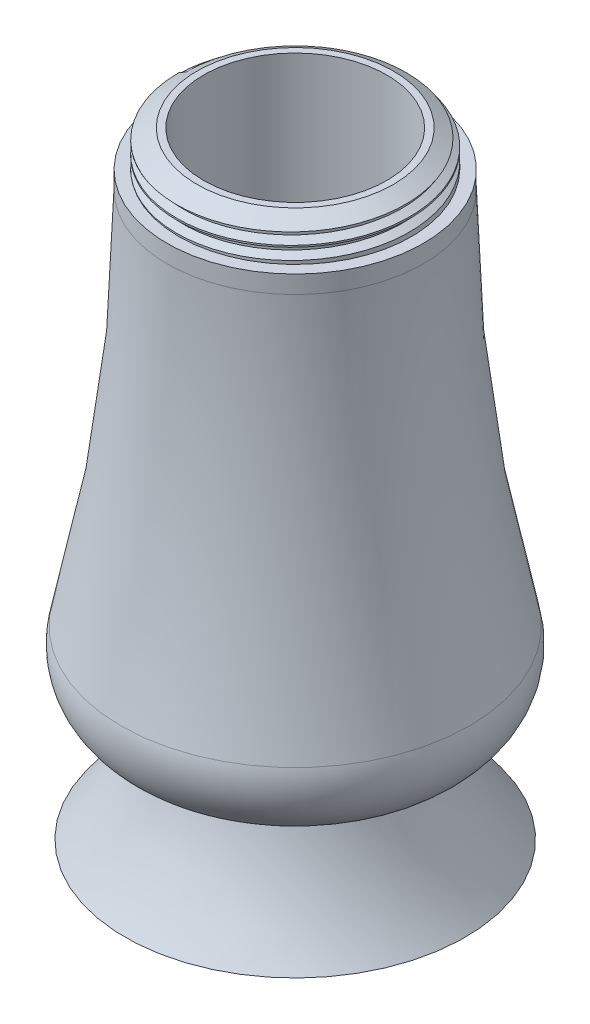
from build123d import *
from build123d.topology import SkipClean

# Parameters (mm, degrees)
GWINT1_PITCH               = 1
SZKIC10_R                  = 7
WYTNIJ_WYCI_GNI_CIE2_DEPTH = 25
ZAOKR_GLENIE1_R            = 5


with BuildPart() as part:
    # Szkic2 → Obrót1 (revolve)
    with BuildSketch(Plane.XY, mode=Mode.PRIVATE) as obr_t1_sk:
        with BuildLine():
            Line((0, 0), (0, 8))
            Line((0, 8), (9.027373354, 8))
            ThreePointArc((9.027373354, 8), (10.570833484, 3.780088701), (13, 0))
            Line((13, 0), (0, 0))
        make_face()
    revolve(obr_t1_sk.sketch.rotate(Axis((0, 0, 0), (0, 1, 0)), 90), axis=Axis((0, 0, 0), (0, 1, 0)))

    # Szkic4 → Obrót2 (revolve)
    with BuildSketch(Plane.XY, mode=Mode.PRIVATE) as obr_t2_sk:
        with BuildLine():
            Line((0, 8), (0, 43))
            Line((0, 43), (0, 47.12232406))
            Line((0, 47.12232406), (8.9, 47.12232406))
            Line((8.9, 47.12232406), (8.9, 45.06116203))
            Line((8.9, 45.06116203), (8.9, 44.597825987))
            Line((8.9, 44.597825987), (8.9, 44.463010207))
            Line((8.9, 44.463010207), (8.9, 44.359094252))
            Line((8.9, 44.359094252), (9.8, 44.359094252))
            Line((9.8, 44.359094252), (9.8, 43))
            ThreePointArc((9.8, 43), (11.129787622, 25.311282732), (15, 8))
            Line((15, 8), (0, 8))
        make_face()
    revolve(obr_t2_sk.sketch.rotate(Axis((0, 8, 0), (0, 1, 0)), 90), axis=Axis((0, 8, 0), (0, 1, 0)))

    # Gwint1: the profile of Profil gwintu1 profile screwed along a right-hand helix of 2 turns, 8 arcs to a turn; built about Z, then put on its axis
    with SkipClean():  # the faces are left unmerged after this step: merging them gives an invalid solid
        gwint1_z = Axis((0, 0, 0), (0, 0, 1))
        gwint1_corners = [(8.9003, 0, -0.000173205), (8.9003, 0, 0.875173202), (8.358734125, 0, 0.562499998), (8.358734125, 0, 0.312499998)]
        with BuildLine(mode=Mode.PRIVATE) as gwint1_profile:
            Line(gwint1_corners[0], gwint1_corners[1])
            Line(gwint1_corners[1], gwint1_corners[2])
            Line(gwint1_corners[2], gwint1_corners[3])
            Line(gwint1_corners[3], gwint1_corners[0])
        gwint1_cap = Face(gwint1_profile.wire())
        gwint1_turn_angles = [0, 22.5, 45, 67.5, 90, 112.5, 135, 157.5, 180, 202.5, 225, 247.5, 270, 292.5, 315, 337.5, 360]
        gwint1_turn_weights = [1, 0.9238795325112867, 1, 0.9238795325112867, 1, 0.9238795325112867, 1, 0.9238795325112867, 1, 0.9238795325112867, 1, 0.9238795325112867, 1, 0.9238795325112867, 1, 0.9238795325112867, 1]
        gwint1_turn_rails = [Edge.make_bspline([Vector(p[0], p[1], 0).rotate(gwint1_z, gwint1_turn_angles[k]) / gwint1_turn_weights[k] + Vector(0, 0, p[2] + GWINT1_PITCH * gwint1_turn_angles[k] / 360) for k in range(17)], [0, 0, 0, 1, 1, 2, 2, 3, 3, 4, 4, 5, 5, 6, 6, 7, 7, 8, 8, 8], 2, gwint1_turn_weights) for p in gwint1_corners]
        gwint1_turn_sides = [Face.make_surface_from_curves(gwint1_turn_rails[p[0]], gwint1_turn_rails[p[1]]) for p in [(0, 1), (1, 2), (2, 3), (3, 0)]]
        gwint1 = Plane(origin=(0, 47.12232406, 0), x_dir=(-1, 0, 0), z_dir=(0, -1, 0)) * Solid(Shell([*[p.moved(Location((0, 0, GWINT1_PITCH * i))) for i in range(2) for p in gwint1_turn_sides], gwint1_cap, gwint1_cap.rotate(gwint1_z, 720).moved(Location((0, 0, GWINT1_PITCH * 720 / 360)))]))
        add(gwint1, mode=Mode.SUBTRACT)

    # Wycięcie-wyciągnięcie po ścieżce1: sweep along a path in Szkic8
    with BuildLine(Plane(origin=(0, 47.12232406, 0), x_dir=(1, 0, 0), z_dir=(0, 1, 0))) as wyci_cie_wyci_gni_cie_po_cie_ce1_path:
        CenterArc((0, 0), 13, 0, 360)
    # Szkic9 → Wycięcie-wyciągnięcie po ścieżce1 (sweep, cut)
    with BuildSketch(Plane.XY):
        Polygon((8.9, 47.12232406), (8.9, 46.32232406), (7.514359354, 47.12232406), align=None)
    sweep(path=wyci_cie_wyci_gni_cie_po_cie_ce1_path.line, mode=Mode.SUBTRACT)

    # Szkic10 → Wytnij-wyciągnięcie2 (cut)
    with BuildSketch(Plane(origin=(0, 47.12232406, 0), x_dir=(1, 0, 0), z_dir=(0, 1, 0))):
        with Locations(Location((0, 0, 0), (0, 0, 270))):
            Circle(SZKIC10_R)
    extrude(amount=-WYTNIJ_WYCI_GNI_CIE2_DEPTH, mode=Mode.SUBTRACT)

    # Zaokrąglenie1
    # the kernel refuses this fillet: 5 mm, written as the material it takes off along each edge
    with BuildSketch(Plane(origin=(0, 8, 0), x_dir=(0, 0, -1), z_dir=(1, 0, 0))) as zaokr_glenie1_piece_1:
        with BuildLine():
            CenterArc((8.463528587, 4.968106186), ZAOKR_GLENIE1_R, 276.47495836, 97.293161414)
            Line((9.027373354, 0), (15, 0))
            ThreePointArc((15, 0), (14.119819715, 3.068091884), (13.319862852, 6.158071522))
        make_face()
    revolve(axis=Axis((0, 8, 0), (0, 1, 0)), mode=Mode.SUBTRACT)


solid = part.part
